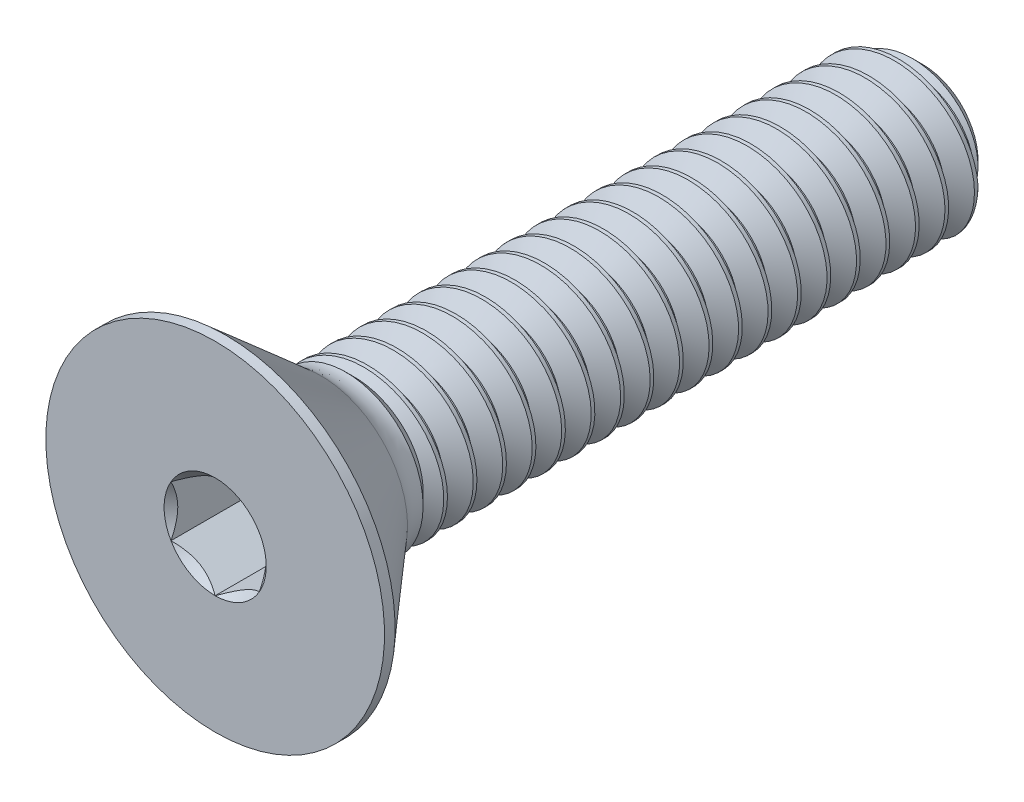
from build123d import *

# Parameters (mm, degrees)
SKETCH1_W          = 19.05
SKETCH1_H          = 2.0828
CHAMFER1_SIZE      = 0.5953125
CUT_SWEEP1_PITCH   = 0.79375
CUT_EXTRUDE2_DEPTH = 1.99136


with BuildPart() as part:
    # Sketch1 → Revolve1 (revolve)
    with BuildSketch(Plane(origin=(0, 0, 0), x_dir=(0, 0, -1), z_dir=(1, 0, 0))):
        with Locations((9.525, 1.0414)):
            Rectangle(SKETCH1_W, SKETCH1_H)
    revolve(axis=Axis((0, 0, -19.05), (0, 0, 1)))

    # Chamfer1
    chamfer1_edges = [part.edges().sort_by_distance(p)[0] for p in [
        (0, -2.0828, -19.05),
    ]]
    chamfer(chamfer1_edges, length=CHAMFER1_SIZE)

    # Cut-Sweep1: arcs per turn and ends read off the stored shape
    # Cut-Sweep1: the profile of Sketch2 profile screwed along a right-hand helix through 25 turns, 8 arcs to a turn; built about Z, then put on its axis
    cut_sweep1_z = Axis((0, 0, 0), (0, 0, 1))
    cut_sweep1_corners = [(2.0831, 0, 0.000173205), (2.0831, 0, -0.694704455), (1.567244252, 0, -0.396875), (1.567244252, 0, -0.29765625)]
    with BuildLine(mode=Mode.PRIVATE) as cut_sweep1_profile:
        Line(cut_sweep1_corners[0], cut_sweep1_corners[1])
        Line(cut_sweep1_corners[1], cut_sweep1_corners[2])
        Line(cut_sweep1_corners[2], cut_sweep1_corners[3])
        Line(cut_sweep1_corners[3], cut_sweep1_corners[0])
    cut_sweep1_cap = Face(cut_sweep1_profile.wire())
    cut_sweep1_turn_angles = [0, 22.5, 45, 67.5, 90, 112.5, 135, 157.5, 180, 202.5, 225, 247.5, 270, 292.5, 315, 337.5, 360]
    cut_sweep1_turn_weights = [1, 0.9238795325112867, 1, 0.9238795325112867, 1, 0.9238795325112867, 1, 0.9238795325112867, 1, 0.9238795325112867, 1, 0.9238795325112867, 1, 0.9238795325112867, 1, 0.9238795325112867, 1]
    cut_sweep1_turn_rails = [Edge.make_bspline([Vector(p[0], p[1], 0).rotate(cut_sweep1_z, cut_sweep1_turn_angles[k]) / cut_sweep1_turn_weights[k] + Vector(0, 0, p[2] + CUT_SWEEP1_PITCH * cut_sweep1_turn_angles[k] / 360) for k in range(17)], [0, 0, 0, 1, 1, 2, 2, 3, 3, 4, 4, 5, 5, 6, 6, 7, 7, 8, 8, 8], 2, cut_sweep1_turn_weights) for p in cut_sweep1_corners]
    cut_sweep1_turn_sides = [Face.make_surface_from_curves(cut_sweep1_turn_rails[p[0]], cut_sweep1_turn_rails[p[1]]) for p in [(0, 1), (1, 2), (2, 3), (3, 0)]]
    cut_sweep1 = Plane(origin=(0, 0, -19.05), x_dir=(0, 1, 0), z_dir=(0, 0, 1)) * Solid(Shell([*[p.moved(Location((0, 0, CUT_SWEEP1_PITCH * i))) for i in range(25) for p in cut_sweep1_turn_sides], cut_sweep1_cap, cut_sweep1_cap.rotate(cut_sweep1_z, 9000).moved(Location((0, 0, CUT_SWEEP1_PITCH * 9000 / 360)))]))
    add(cut_sweep1, mode=Mode.SUBTRACT)

    # Sketch7 → Revolve2 (revolve)
    with BuildSketch(Plane(origin=(0, 0, 0), x_dir=(0, 0, -1), z_dir=(1, 0, 0)), mode=Mode.PRIVATE) as revolve2_sk:
        with BuildLine():
            Line((0, 4.5593), (0.28448, 4.5593))
            Line((0.28448, 4.5593), (2.8448, 2.333647779))
            ThreePointArc((2.8448, 2.333647779), (3.157581097, 2.147562581), (3.515722863, 2.0828))
            Line((3.515722863, 2.0828), (3.515722863, 0))
            Line((3.515722863, 0), (0, 0))
            Line((0, 0), (0, 4.5593))
        make_face()
    revolve(revolve2_sk.sketch.rotate(Axis((0, 0, 0), (0, 0, -1)), 189.052465709), axis=Axis((0, 0, 0), (0, 0, -1)))

    # Boss-Extrude1 cone 1 section (through the dimple's axis) → Boss-Extrude1 (revolve)
    with BuildSketch(Plane(origin=(0, 0, -3.515722863), x_dir=(0, -1, 0), z_dir=(1, 0, 0))):
        Polygon((0, 0), (2.0828, 0), (0, 2.0828), align=None)
    revolve(axis=Axis((0, 0, -3.515722863), (0, 0, -1)))

    # Sketch5 → Cut-Extrude2 (cut)
    with BuildSketch(Plane.XY):
        Polygon((1.190625, -0.687407664), (1.190625, 0.687407664), (0, 1.374815329), (-1.190625, 0.687407664), (-1.190625, -0.687407664), (0, -1.374815329), align=None)
    extrude(amount=-CUT_EXTRUDE2_DEPTH, mode=Mode.SUBTRACT)

    # Cut-Extrude3 cone 1 section (through the dimple's axis) → Cut-Extrude3 (revolve, cut)
    with BuildSketch(Plane(origin=(0, 0, 0), x_dir=(0, -1, 0), z_dir=(1, 0, 0))):
        Polygon((0, 0), (1.374815329, 0), (0, 1.374815329), align=None)
    revolve(axis=Axis((0, 0, 0), (0, 0, -1)), mode=Mode.SUBTRACT)


solid = part.part
